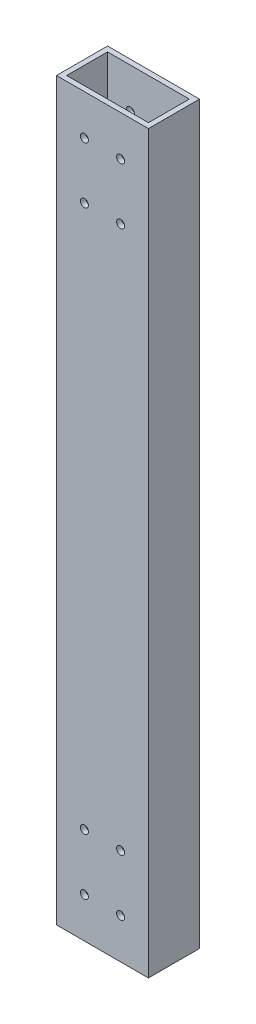
from build123d import *

# Parameters (mm, degrees)
SKETCH1_W           = 57.15
SKETCH1_H           = 31.75
SKETCH1_W_2         = 50.8
SKETCH1_H_2         = 25.4
BOSS_EXTRUDE1_DEPTH = 457.2
SKETCH2_R           = 2.5
CUT_EXTRUDE1_DEPTH  = 460.191063856


with BuildPart() as part:
    # Sketch1 → Boss-Extrude1 (new body)
    with BuildSketch(Plane(origin=(0, 0, 0), x_dir=(1, 0, 0), z_dir=(0, 1, 0))):
        Rectangle(SKETCH1_W, SKETCH1_H)
        Rectangle(SKETCH1_W_2, SKETCH1_H_2, mode=Mode.SUBTRACT)
    extrude(amount=BOSS_EXTRUDE1_DEPTH)

    # Sketch2 → Cut-Extrude1 (cut, through all)
    with BuildSketch(Plane.XY.offset(15.875)):
        with Locations((-11.25, 60)):
            Circle(SKETCH2_R)
        with Locations((-11.25, 25)):
            Circle(SKETCH2_R)
        with Locations((11.25, 25)):
            Circle(SKETCH2_R)
        with Locations((11.25, 60)):
            Circle(SKETCH2_R)
    cut_extrude1 = extrude(amount=-CUT_EXTRUDE1_DEPTH, mode=Mode.SUBTRACT)

    # Mirror1: Cut-Extrude1 across plane
    add(cut_extrude1.mirror(Plane(origin=(0, 228.6, 0), x_dir=(0, 0, 1), z_dir=(0, -1, 0))), mode=Mode.SUBTRACT)


solid = part.part
